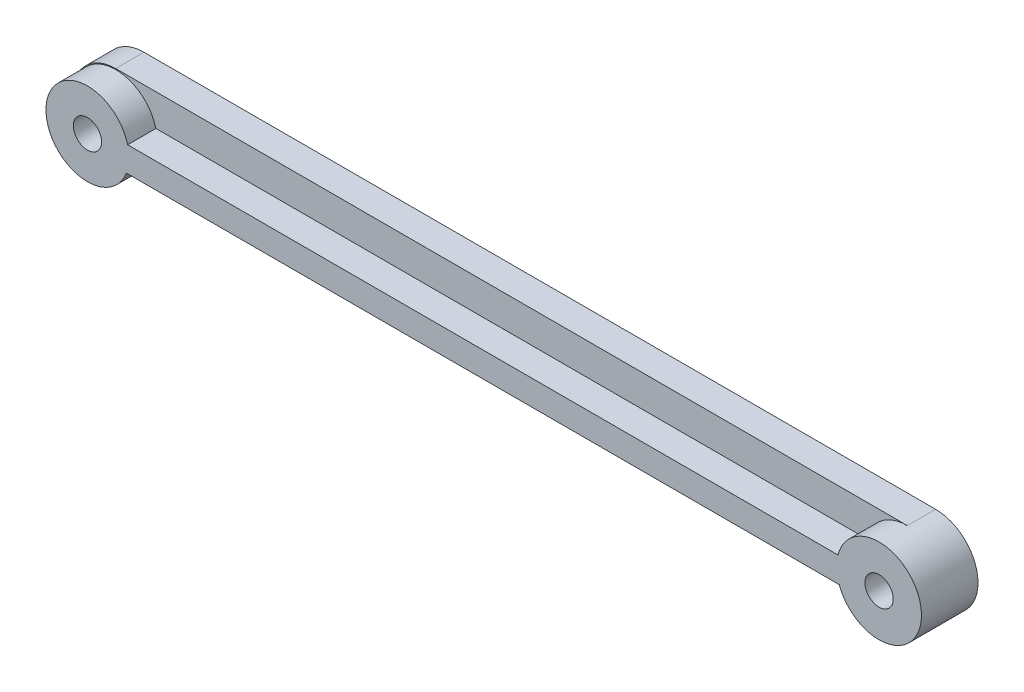
from build123d import *

# Parameters (mm, degrees)
SKETCH_1_R      = 0.5
EXTRUDE_1_DEPTH = 1
SKETCH_2_R      = 0.5
EXTRUDE_3_DEPTH = 1


with BuildPart() as part:
    # 草图1 → 凸台-拉伸1 (new body)
    with BuildSketch(Plane.XY):
        with BuildLine():
            Line((0, 1.5), (28, 1.5))
            ThreePointArc((28, 1.5), (29.5, 0), (28, -1.5))
            Line((28, -1.5), (0, -1.5))
            ThreePointArc((0, -1.5), (-1.5, 0), (0, 1.5))
        make_face()
        Circle(SKETCH_1_R, mode=Mode.SUBTRACT)
        with Locations((28, 0)):
            Circle(SKETCH_1_R, mode=Mode.SUBTRACT)
    extrude(amount=EXTRUDE_1_DEPTH)

    # 草图2 → 凸台-拉伸3 (add)
    with BuildSketch(Plane.XY.offset(1)):
        with BuildLine():
            Line((1.420341395, 0.37453303), (26.547510754, 0.37453303))
            ThreePointArc((26.547510754, 0.37453303), (29.498226645, 0.072917208), (26.590745591, -0.513811261))
            Line((26.590745591, -0.513811261), (1.376096892, -0.513811261))
            ThreePointArc((1.376096892, -0.513811261), (-1.467073845, 0.073068464), (1.420341395, 0.37453303))
        make_face()
        Circle(SKETCH_2_R, mode=Mode.SUBTRACT)
        with Locations((28, 0)):
            Circle(SKETCH_2_R, mode=Mode.SUBTRACT)
    extrude(amount=EXTRUDE_3_DEPTH)


solid = part.part
